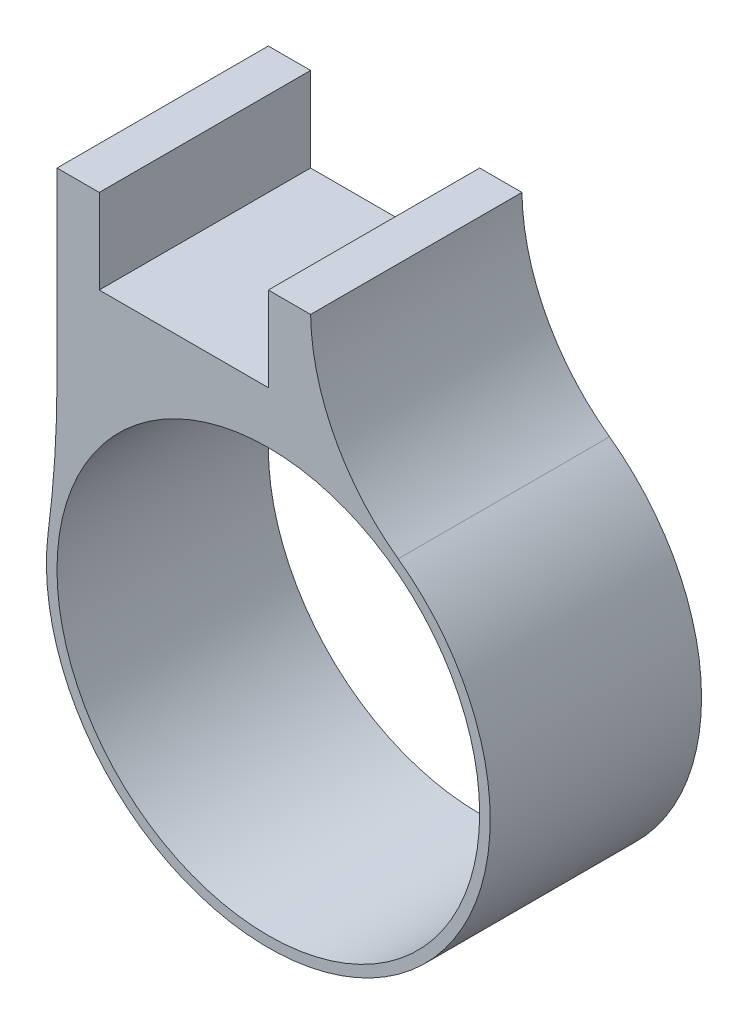
from build123d import *

# Parameters (mm, degrees)
SKETCH1_R           = 10.5
SKETCH1_R_2         = 10
BOSS_EXTRUDE1_DEPTH = 10
FILLET1_R           = 50
FILLET2_R           = 10


with BuildPart() as part:
    # Sketch1 → Boss-Extrude1 (new body)
    # profile 1 of 2: a face of its own
    with BuildSketch(Plane.XY):
        with BuildLine():
            Line((-8, 16.455448816), (-10, 16.455448816))
            Line((-10, 16.455448816), (-10, 3.201562119))
            ThreePointArc((-10, 3.201562119), (-5.350189391, 9.034681703), (2, 10.307764064))
            Line((2, 10.307764064), (2, 16.455448816))
            Line((2, 16.455448816), (0, 16.455448816))
            Line((0, 16.455448816), (0, 12.455448816))
            Line((0, 12.455448816), (-8, 12.455448816))
            Line((-8, 12.455448816), (-8, 16.455448816))
        make_face()
    # profile 2 of 2: a face of its own
    with BuildSketch(Plane.XY):
        Circle(SKETCH1_R)
        Circle(SKETCH1_R_2, mode=Mode.SUBTRACT)
    extrude(amount=BOSS_EXTRUDE1_DEPTH)

    # Fillet1
    fillet1_edges = [part.edges().sort_by_distance(p)[0] for p in [
        (-10, 3.201562119, 5),
    ]]
    fillet(fillet1_edges, radius=FILLET1_R)

    # Fillet2
    # the kernel refuses this fillet: 10 mm, written as the material it adds along each edge
    with BuildSketch(Plane(origin=(2, 10.307764064, 0), x_dir=(0.9177385180752605, -0.3971851110515409, 0), z_dir=(0, 0, 1))) as fillet2_piece_1:
        with BuildLine():
            CenterArc((6.668287117, 9.765906989), FILLET2_R, 204.355310462, 53.22294126)
            Line((-2.441768851, 5.641967094), (-2.62396997, 5.559488296))
            ThreePointArc((-2.62396997, 5.559488296), (-1.404432129, 2.741546525), (-0.183547704, -0.079437022))
            Line((-0.183547704, -0.079437022), (0.043021207, -0.19531814))
            ThreePointArc((0.043021207, -0.19531814), (2.258613378, 0.045797661), (4.474205549, -0.19531814))
            Line((4.474205549, -0.19531814), (4.517226757, 0))
        make_face()
    extrude(amount=10)


solid = part.part
